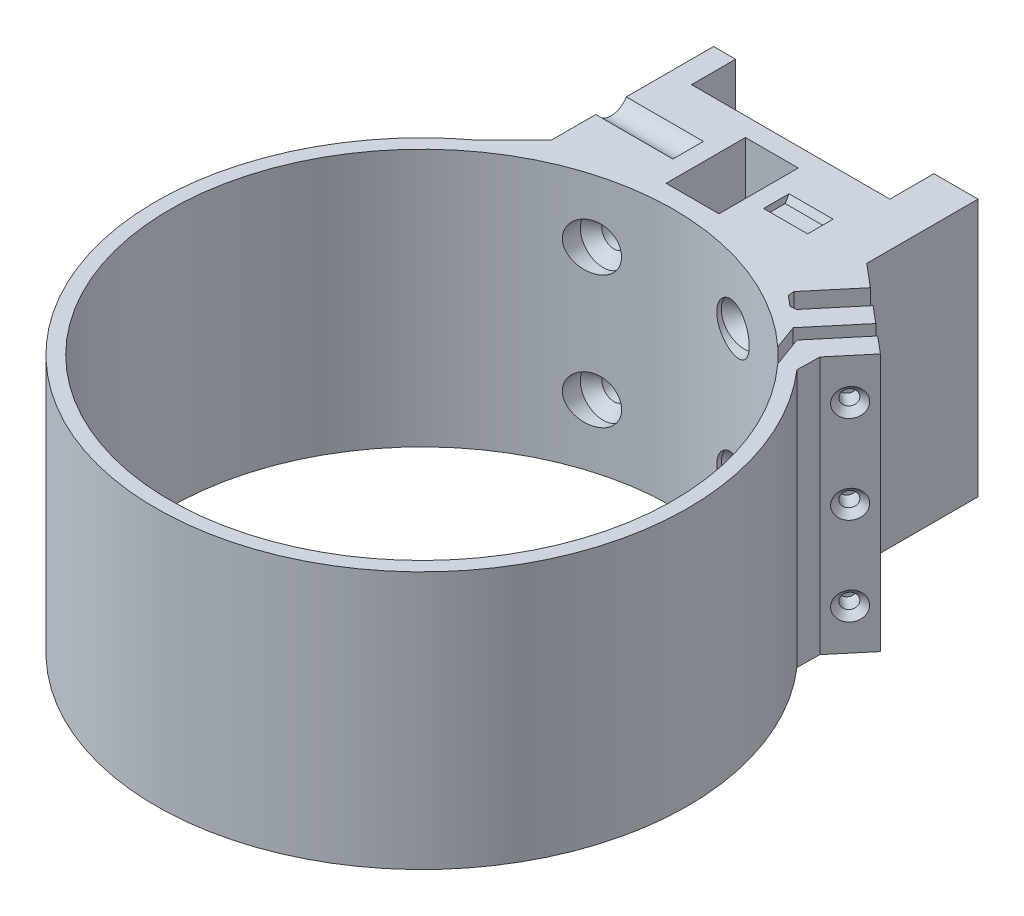
from build123d import *

# Parameters (mm, degrees)
SKETCH1_W                                       = 12
SKETCH1_H                                       = 18
BOSS_EXTRUDE1_DEPTH                             = 29.25
SKETCH4_W                                       = 45
SKETCH4_H                                       = 10
BOSS_EXTRUDE2_DEPTH                             = 4.5
CSK_FOR_M5_FLAT_HEAD_MACHINE_SCREW1_AT_2_COUNT  = 2
CSK_FOR_M5_FLAT_HEAD_MACHINE_SCREW1_AT_2_PITCH  = 32
CSK_FOR_M5_FLAT_HEAD_MACHINE_SCREW1_AT_3_COUNT  = 2
CSK_FOR_M5_FLAT_HEAD_MACHINE_SCREW1_AT_3_PITCH  = 43.863424399
CSK_FOR_M5_FLAT_HEAD_MACHINE_SCREW1_AT_4_COUNT  = 2
CSK_FOR_M5_FLAT_HEAD_MACHINE_SCREW1_AT_4_PITCH  = 30
CUT_EXTRUDE1_REACH                              = 137.259
CUT_EXTRUDE1_END_RADIUS                         = 57.15
SKETCH13_R                                      = 5.2
CHAMFER1_SIZE                                   = 3.556619638
CHAMFER1_SIZE_2                                 = 3.175
CHAMFER2_SIZE                                   = 1
CSK_FOR_M3_FLAT_HEAD_MACHINE_SCREW1_D           = 3.4
CSK_FOR_M3_FLAT_HEAD_MACHINE_SCREW1_DEPTH       = 15
CSK_FOR_M3_FLAT_HEAD_MACHINE_SCREW1_CSINK_D     = 6.3
CSK_FOR_M3_FLAT_HEAD_MACHINE_SCREW1_CSINK_ANGLE = 90
CSK_FOR_M3_FLAT_HEAD_MACHINE_SCREW1_TIP         = 1.021463052
SKETCH17_R                                      = 4
CUT_EXTRUDE2_DEPTH                              = 17.5
CUT_EXTRUDE3_START                              = -4
CUT_EXTRUDE3_DEPTH                              = 10


with BuildPart() as part:
    # Sketch1 → Boss-Extrude1 (new, symmetric)
    with BuildSketch(Plane(origin=(0, 0, 0), x_dir=(1, 0, 0), z_dir=(0, 1, 0))):
        with BuildLine():
            Line((-27.5, 53.692230583), (-27.5, 93.692230583))
            Line((-27.5, 93.692230583), (-22.5, 93.692230583))
            Line((-22.5, 93.692230583), (-22.5, 83.692230583))
            Line((-22.5, 83.692230583), (22.5, 83.692230583))
            Line((22.5, 83.692230583), (22.5, 93.692230583))
            Line((22.5, 93.692230583), (32.5, 93.692230583))
            Line((32.5, 93.692230583), (32.5, 68.433749194))
            Line((32.5, 68.433749194), (37.690810999, 64.078141599))
            Line((37.690810999, 64.078141599), (29.139173324, 53.886696677))
            Line((29.139173324, 53.886696677), (32.96939554, 50.672758629))
            Line((32.96939554, 50.672758629), (41.521033215, 60.864203551))
            Line((41.521033215, 60.864203551), (45.351255431, 57.650265502))
            Line((45.351255431, 57.650265502), (36.799617755, 47.45882058))
            Line((36.799617755, 47.45882058), (38.801277269, 41.959306266))
            ThreePointArc((38.801277269, 41.959306266), (-40.514490328, -40.307549832), (42.157451983, 38.585900823))
            Line((42.157451983, 38.585900823), (39.655856522, 45.458977865))
            Line((39.655856522, 45.458977865), (48.012095448, 55.417555625))
            Line((48.012095448, 55.417555625), (51.842317663, 52.203617577))
            Line((51.842317663, 52.203617577), (43.290679988, 42.012172655))
            ThreePointArc((43.290679988, 42.012172655), (-9.820505686, -59.520276319), (-27.5, 53.692230583))
        make_face()
        with Locations((0, 70.421115292)):
            Rectangle(SKETCH1_W, SKETCH1_H, mode=Mode.SUBTRACT)
    extrude(amount=BOSS_EXTRUDE1_DEPTH, both=True)

    # Sketch4 → Boss-Extrude2 (add)
    with BuildSketch(Plane.XZ.offset(29.25)):
        with Locations((0, -88.692230583)):
            Rectangle(SKETCH4_W, SKETCH4_H)
    extrude(amount=-BOSS_EXTRUDE2_DEPTH)

    # Sketch12 → CSK for M5 Flat Head Machine Screw1 (revolve, cut)
    with BuildSketch(Plane(origin=(-16, 15, -57.15), x_dir=(0, -1, 0), z_dir=(1, 0, 0))):
        Polygon((0, 0), (0, 36.542230583), (2.75, 36.542230583), (2.75, 2.45), (5.2, 0), align=None)
    csk_for_m5_flat_head_machine_screw1 = revolve(axis=Axis((-16, 15, -50.8), (0, 0, -1)), mode=Mode.SUBTRACT)

    # CSK for M5 Flat Head Machine Screw1 at 2: CSK for M5 Flat Head Machine Screw1 ×2
    with Locations(*[(i * CSK_FOR_M5_FLAT_HEAD_MACHINE_SCREW1_AT_2_PITCH, 0, 0) for i in range(1, CSK_FOR_M5_FLAT_HEAD_MACHINE_SCREW1_AT_2_COUNT)]):
        add(csk_for_m5_flat_head_machine_screw1, mode=Mode.SUBTRACT)

    # CSK for M5 Flat Head Machine Screw1 at 3: CSK for M5 Flat Head Machine Screw1 ×2
    with Locations(*[Vector(0.7295372041400852, -0.6839411288813297, 0) * (i * CSK_FOR_M5_FLAT_HEAD_MACHINE_SCREW1_AT_3_PITCH) for i in range(1, CSK_FOR_M5_FLAT_HEAD_MACHINE_SCREW1_AT_3_COUNT)]):
        add(csk_for_m5_flat_head_machine_screw1, mode=Mode.SUBTRACT)

    # CSK for M5 Flat Head Machine Screw1 at 4: CSK for M5 Flat Head Machine Screw1 ×2
    with Locations(*[(0, -i * CSK_FOR_M5_FLAT_HEAD_MACHINE_SCREW1_AT_4_PITCH, 0) for i in range(1, CSK_FOR_M5_FLAT_HEAD_MACHINE_SCREW1_AT_4_COUNT)]):
        add(csk_for_m5_flat_head_machine_screw1, mode=Mode.SUBTRACT)

    # Cut-Extrude1: up to this cylinder (the profile starts outside it)
    cut_extrude1_end = Plane(origin=(0, 0, 0), z_dir=(0, -1, 0)) * Cylinder(CUT_EXTRUDE1_END_RADIUS, 419.818, mode=Mode.PRIVATE)
    # Sketch13 → Cut-Extrude1 (cut, up to the surface)
    with BuildSketch(Plane.XY.offset(-57.15), mode=Mode.PRIVATE) as cut_extrude1_sk1:
        with Locations(Location((-16, -15, 0), (0, 0, 180))):
            Circle(SKETCH13_R)
    cut_extrude1_tool1 = extrude(cut_extrude1_sk1.sketch, amount=CUT_EXTRUDE1_REACH, mode=Mode.PRIVATE) - cut_extrude1_end
    add(cut_extrude1_tool1.solids().sort_by_distance((-16, -15, -57.15))[0], mode=Mode.SUBTRACT)
    # Sketch13 → Cut-Extrude1 (cut, up to the surface)
    with BuildSketch(Plane.XY.offset(-57.15), mode=Mode.PRIVATE) as cut_extrude1_sk2:
        with Locations(Location((16, -15, 0), (0, 0, 180))):
            Circle(SKETCH13_R)
    cut_extrude1_tool2 = extrude(cut_extrude1_sk2.sketch, amount=CUT_EXTRUDE1_REACH, mode=Mode.PRIVATE) - cut_extrude1_end
    add(cut_extrude1_tool2.solids().sort_by_distance((16, -15, -57.15))[0], mode=Mode.SUBTRACT)
    # Sketch13 → Cut-Extrude1 (cut, up to the surface)
    with BuildSketch(Plane.XY.offset(-57.15), mode=Mode.PRIVATE) as cut_extrude1_sk3:
        with Locations(Location((16, 15, 0), (0, 0, 180))):
            Circle(SKETCH13_R)
    cut_extrude1_tool3 = extrude(cut_extrude1_sk3.sketch, amount=CUT_EXTRUDE1_REACH, mode=Mode.PRIVATE) - cut_extrude1_end
    add(cut_extrude1_tool3.solids().sort_by_distance((16, 15, -57.15))[0], mode=Mode.SUBTRACT)
    # Sketch13 → Cut-Extrude1 (cut, up to the surface)
    with BuildSketch(Plane.XY.offset(-57.15), mode=Mode.PRIVATE) as cut_extrude1_sk4:
        with Locations(Location((-16, 15, 0), (0, 0, 180))):
            Circle(SKETCH13_R)
    cut_extrude1_tool4 = extrude(cut_extrude1_sk4.sketch, amount=CUT_EXTRUDE1_REACH, mode=Mode.PRIVATE) - cut_extrude1_end
    add(cut_extrude1_tool4.solids().sort_by_distance((-16, 15, -57.15))[0], mode=Mode.SUBTRACT)

    # Chamfer1
    # the kernel refuses this chamfer: 7.31254539, 3.556619638, 3.175 mm, written as the material it adds along each edge
    with BuildSketch(Plane(origin=(43.290679988, -29.25, -42.012172655), x_dir=(0.6767582135890655, 0, 0.736205352017857), z_dir=(0, 1, 0))) as chamfer1_piece_1:
        with BuildLine():
            Line((3.264526209, 0), (-CHAMFER1_SIZE * 0.128954224472, CHAMFER1_SIZE * 0.99165054742))
            Line((-CHAMFER1_SIZE * 0.128954224472, CHAMFER1_SIZE * 0.99165054742), (0, 0))
            ThreePointArc((0, 0), (1.683964682, 0.02206463), (3.264526209, 0))
        make_face()
    extrude(amount=58.5)
    with BuildSketch(Plane(origin=(-27.5, -29.25, -53.692230583), x_dir=(0, 0, -1), z_dir=(0, 1, 0))) as chamfer1_piece_2:
        with BuildLine():
            Line((CHAMFER1_SIZE_2, 0), (-5.17652137, 8.35152137))
            ThreePointArc((-5.17652137, 8.35152137), (-2.493388985, 4.40273098), (0, 0))
            Line((0, 0), (CHAMFER1_SIZE_2, 0))
        make_face()
    extrude(amount=58.5)

    # Chamfer2
    chamfer2_edges = [part.edges().sort_by_distance(p)[0] for p in [
        (29.139173324, 0, -53.886696677),
        (32.96939554, 0, -50.672758629),
    ]]
    chamfer(chamfer2_edges, length=CHAMFER2_SIZE)

    # CSK for M3 Flat Head Machine Screw1
    with Locations(Plane(origin=(4.717057163, 0, 3.958080926), x_dir=(0.6427876096865344, 0, -0.7660444431189822), z_dir=(0.7660444431189822, 0, 0.6427876096865344))):
        with Locations((68.440207181, 20), (68.440207181, 0), (68.440207181, -20)):
            CounterSinkHole(CSK_FOR_M3_FLAT_HEAD_MACHINE_SCREW1_D / 2, CSK_FOR_M3_FLAT_HEAD_MACHINE_SCREW1_CSINK_D / 2, depth=CSK_FOR_M3_FLAT_HEAD_MACHINE_SCREW1_DEPTH, counter_sink_angle=CSK_FOR_M3_FLAT_HEAD_MACHINE_SCREW1_CSINK_ANGLE)
            with Locations((0, 0, -(CSK_FOR_M3_FLAT_HEAD_MACHINE_SCREW1_DEPTH + CSK_FOR_M3_FLAT_HEAD_MACHINE_SCREW1_TIP / 2))):  # 118° drill point
                Cone(0, CSK_FOR_M3_FLAT_HEAD_MACHINE_SCREW1_D / 2, CSK_FOR_M3_FLAT_HEAD_MACHINE_SCREW1_TIP, mode=Mode.SUBTRACT)

    # Sketch17 → Cut-Extrude2 (cut)
    with BuildSketch(Plane.ZY.offset(27.5)):
        with Locations((-70.421115292, 31.25)):
            Circle(SKETCH17_R)
    cut_extrude2 = extrude(amount=-CUT_EXTRUDE2_DEPTH, mode=Mode.SUBTRACT)

    # Sketch19 → Cut-Extrude3 (cut)
    with BuildSketch(Plane.ZY.offset(-6).offset(CUT_EXTRUDE3_START)):
        Polygon((-68.400389349, 34.75), (-72.441841234, 34.75), (-74.462567176, 31.25), (-72.441841234, 27.75), (-68.400389349, 27.75), (-66.379663407, 31.25), align=None)
    cut_extrude3 = extrude(amount=-CUT_EXTRUDE3_DEPTH, mode=Mode.SUBTRACT)

    # Mirror1: Cut-Extrude2, Cut-Extrude3 across plane
    add(cut_extrude2.mirror(Plane.ZX), mode=Mode.SUBTRACT)
    add(cut_extrude3.mirror(Plane.ZX), mode=Mode.SUBTRACT)


solid = part.part
